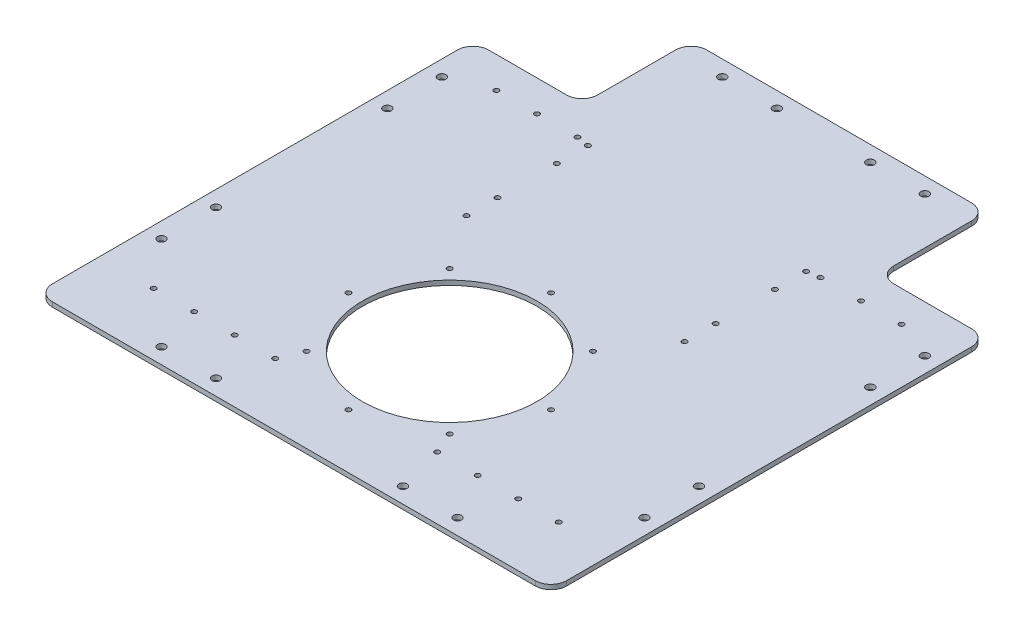
from build123d import *

# Parameters (mm, degrees)
SKETCH1_R           = 56
BOSS_EXTRUDE1_DEPTH = 3
FILLET1_R           = 10
SKETCH2_R           = 2.6
SKETCH2_R_2         = 1.6
CUT_EXTRUDE1_DEPTH  = 482.049893462
SKETCH3_R           = 1.6
CUT_EXTRUDE2_DEPTH  = 482.049893462


with BuildPart() as part:
    # Sketch1 → Boss-Extrude1 (new body)
    with BuildSketch(Plane(origin=(0, 0, 0), x_dir=(1, 0, 0), z_dir=(0, 1, 0))):
        Polygon((0, 280), (0, 0), (330, 0), (330, 280), (260, 280), (260, 350), (70, 350), (70, 280), align=None)
        with Locations((165, 100)):
            Circle(SKETCH1_R, mode=Mode.SUBTRACT)
    extrude(amount=BOSS_EXTRUDE1_DEPTH)

    # Fillet1
    fillet1_edges = [part.edges().sort_by_distance(p)[0] for p in [
        (0, 1.5, 0),
        (330, 1.5, 0),
        (330, 1.5, -280),
        (260, 1.5, -350),
        (260, 1.5, -280),
        (70, 1.5, -280),
        (70, 1.5, -350),
        (0, 1.5, -280),
    ]]
    fillet(fillet1_edges, radius=FILLET1_R)

    # Sketch2 → Cut-Extrude1 (cut, through all)
    with BuildSketch(Plane(origin=(0, 3, 0), x_dir=(1, 0, 0), z_dir=(0, 1, 0))):
        with Locations((100, 340)):
            Circle(SKETCH2_R)
        with Locations((230, 340)):
            Circle(SKETCH2_R)
        with Locations((320, 250)):
            Circle(SKETCH2_R)
        with Locations((320, 70)):
            Circle(SKETCH2_R)
        with Locations((260, 10)):
            Circle(SKETCH2_R)
        with Locations((10, 70)):
            Circle(SKETCH2_R)
        with Locations((70, 10)):
            Circle(SKETCH2_R)
        with Locations((10, 250)):
            Circle(SKETCH2_R)
        with Locations((165, 165)):
            Circle(SKETCH2_R_2)
        with Locations((35, 260)):
            Circle(SKETCH2_R_2)
        with Locations((61, 260)):
            Circle(SKETCH2_R_2)
        with Locations((87, 260)):
            Circle(SKETCH2_R_2)
        with Locations((243, 260)):
            Circle(SKETCH2_R_2)
        with Locations((269, 260)):
            Circle(SKETCH2_R_2)
        with Locations((295, 260)):
            Circle(SKETCH2_R_2)
        with Locations((35, 40)):
            Circle(SKETCH2_R_2)
        with Locations((61, 40)):
            Circle(SKETCH2_R_2)
        with Locations((87, 40)):
            Circle(SKETCH2_R_2)
        with Locations((113, 40)):
            Circle(SKETCH2_R_2)
        with Locations((10, 215)):
            Circle(SKETCH2_R)
        with Locations((10, 105)):
            Circle(SKETCH2_R)
        with Locations((105, 10)):
            Circle(SKETCH2_R)
        with Locations((225, 10)):
            Circle(SKETCH2_R)
        with Locations((320, 105)):
            Circle(SKETCH2_R)
        with Locations((320, 215)):
            Circle(SKETCH2_R)
        with Locations((135, 340)):
            Circle(SKETCH2_R)
        with Locations((195, 340)):
            Circle(SKETCH2_R)
        with Locations((295, 40)):
            Circle(SKETCH2_R_2)
        with Locations((269, 40)):
            Circle(SKETCH2_R_2)
        with Locations((243, 40)):
            Circle(SKETCH2_R_2)
        with Locations((217, 40)):
            Circle(SKETCH2_R_2)
        with Locations((210.961940777, 145.961940777)):
            Circle(SKETCH2_R_2)
        with Locations((230, 100)):
            Circle(SKETCH2_R_2)
        with Locations((210.961940777, 54.038059223)):
            Circle(SKETCH2_R_2)
        with Locations((165, 35)):
            Circle(SKETCH2_R_2)
        with Locations((119.038059223, 54.038059223)):
            Circle(SKETCH2_R_2)
        with Locations((100, 100)):
            Circle(SKETCH2_R_2)
        with Locations((119.038059223, 145.961940777)):
            Circle(SKETCH2_R_2)
    extrude(amount=-CUT_EXTRUDE1_DEPTH, mode=Mode.SUBTRACT)

    # Sketch3 → Cut-Extrude2 (cut, through all)
    with BuildSketch(Plane(origin=(0, 3, 0), x_dir=(1, 0, 0), z_dir=(0, 1, 0))):
        with Locations((95, 258.75)):
            Circle(SKETCH3_R)
        with Locations((95, 238.75)):
            Circle(SKETCH3_R)
        with Locations((95, 200.75)):
            Circle(SKETCH3_R)
        with Locations((95, 180.75)):
            Circle(SKETCH3_R)
        with Locations((235, 180.75)):
            Circle(SKETCH3_R)
        with Locations((235, 200.75)):
            Circle(SKETCH3_R)
        with Locations((235, 238.75)):
            Circle(SKETCH3_R)
        with Locations((235, 258.75)):
            Circle(SKETCH3_R)
    extrude(amount=-CUT_EXTRUDE2_DEPTH, mode=Mode.SUBTRACT)


solid = part.part
